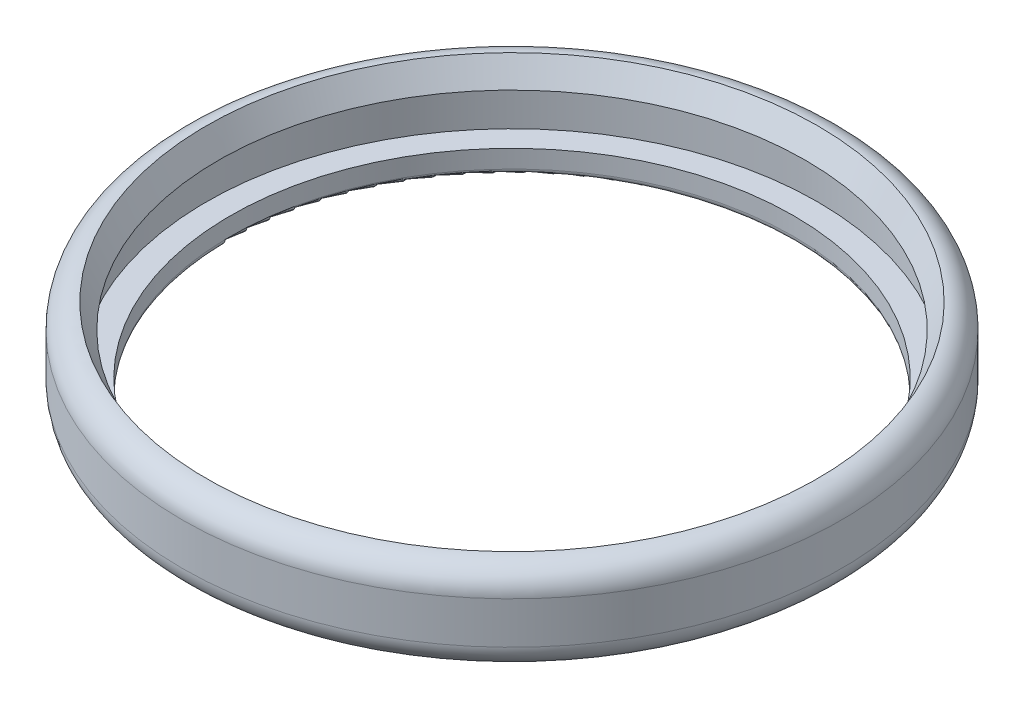
from build123d import *

# Parameters (mm, degrees)
FILLET2_R = 2
FILLET3_R = 0.5


with BuildPart() as part:
    # Sketch1 → Revolve1 (revolve)
    with BuildSketch(Plane.XY, mode=Mode.PRIVATE) as revolve1_sk:
        Polygon((25.5, 0), (23.5, 0), (23.5, -2), (27.5, -2), (27.5, 5.5), (25.5, 5.5), (24.5, 3.5), (25.5, 3.5), align=None)
    revolve(revolve1_sk.sketch.rotate(Axis((0, 0, 0), (0, 1, 0)), 90), axis=Axis((0, 0, 0), (0, 1, 0)))

    # Fillet2
    fillet2_edges = [part.edges().sort_by_distance(p)[0] for p in [
        (0, -2, 27.5),
        (0, 5.5, 27.5),
    ]]
    fillet(fillet2_edges, radius=FILLET2_R - 0.0001)  # a hair under: the kernel refuses the full size

    # Fillet3
    fillet3_edges = [part.edges().sort_by_distance(p)[0] for p in [
        (0, -2, 23.5),
    ]]
    fillet(fillet3_edges, radius=FILLET3_R)


solid = part.part
